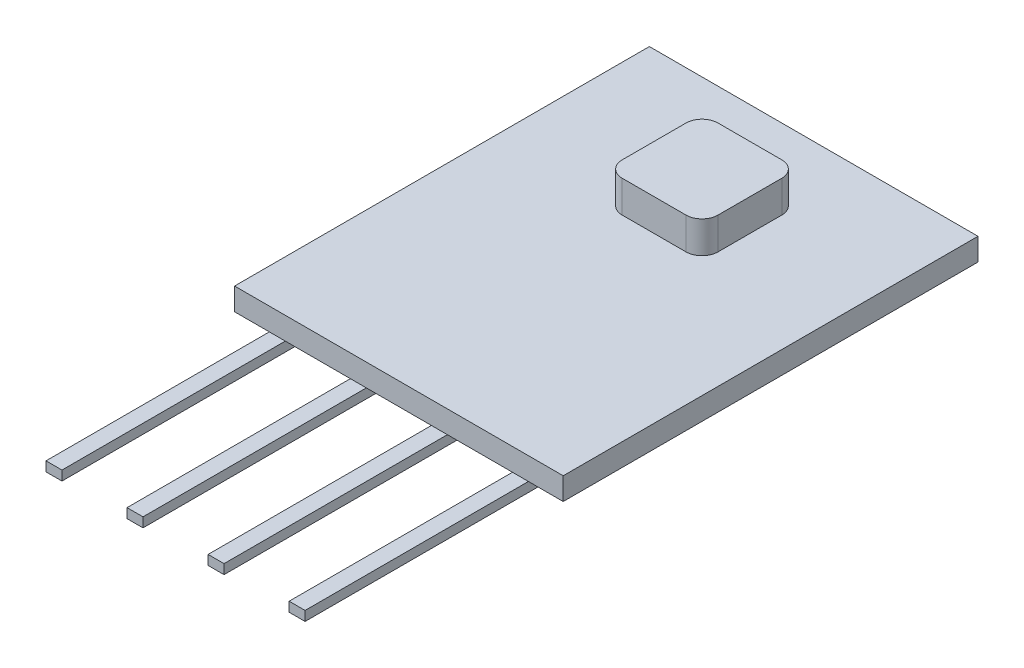
from build123d import *

# Parameters (mm, degrees)
SKETCH_1_W                   = 10.3
SKETCH_1_H                   = 13
EXTRUDE_1_DEPTH              = 0.7
SKETCH_2_W                   = 3
SKETCH_2_H                   = 3
EXTRUDE_2_DEPTH              = 1
FILLET_1_R                   = 0.5
SKETCH_3_W                   = 0.5
SKETCH_3_H                   = 0.5
EXTRUDE_3_DEPTH              = 0.3
SKETCH_4_W                   = 0.5
SKETCH_4_H                   = 0.3
EXTRUDE_4_DEPTH              = 7
PATTERN_START                = 3.56
PATTERN_LINEAR_1_OUTLINE_W   = 0.3
PATTERN_LINEAR_1_OUTLINE_H   = 0.5
PATTERN_LINEAR_1_DEPTH       = 0.5
PATTERN_START_2              = 1.02
PATTERN_LINEAR_1_2_OUTLINE_W = 0.3
PATTERN_LINEAR_1_2_OUTLINE_H = 0.5
PATTERN_LINEAR_1_2_DEPTH     = 0.5
PATTERN_START_3              = -1.52
PATTERN_LINEAR_1_3_OUTLINE_W = 0.3
PATTERN_LINEAR_1_3_OUTLINE_H = 0.5
PATTERN_LINEAR_1_3_DEPTH     = 0.5
PATTERN_START_4              = 6
PATTERN_LINEAR_1_4_OUTLINE_W = 0.5
PATTERN_LINEAR_1_4_OUTLINE_H = 0.3
PATTERN_LINEAR_1_4_DEPTH     = 7.5


# Read off the part's stored shape, not the designer's step: Линейный массив1
with BuildPart() as part:
    # Эскиз1 → Бобышка-Вытянуть1 (new body)
    with BuildSketch(Plane(origin=(0, 0, 0), x_dir=(1, 0, 0), z_dir=(0, 1, 0))):
        Rectangle(SKETCH_1_W, SKETCH_1_H)
    extrude(amount=EXTRUDE_1_DEPTH)



with BuildPart() as body_2:
    # Эскиз2 → Бобышка-Вытянуть2 (new body)
    with BuildSketch(Plane(origin=(0, 0.7, 0), x_dir=(1, 0, 0), z_dir=(0, 1, 0))):
        with Locations((0, 3)):
            Rectangle(SKETCH_2_W, SKETCH_2_H)
    extrude(amount=EXTRUDE_2_DEPTH)

    # Скругление1
    fillet_1_edges = [body_2.edges().sort_by_distance(p)[0] for p in [
        (1.5, 1.2, -1.5),
        (-1.5, 1.2, -1.5),
        (-1.5, 1.2, -4.5),
        (1.5, 1.2, -4.5),
    ]]
    fillet(fillet_1_edges, radius=FILLET_1_R)


with BuildPart() as body_3:
    # Эскиз3 → Бобышка-Вытянуть3 (new body)
    with BuildSketch(Plane.XZ):
        with Locations((-3.81, 6.25)):
            Rectangle(SKETCH_3_W, SKETCH_3_H)
    extrude(amount=EXTRUDE_3_DEPTH)


with BuildPart() as part_1:
    add(part.part)

    add(body_3.part)  # Бобышка-Вытянуть4 merges body 3
    # Эскиз4 → Бобышка-Вытянуть4 (add)
    with BuildSketch(Plane.XY.offset(6.5)):
        with Locations((-3.81, -0.15)):
            Rectangle(SKETCH_4_W, SKETCH_4_H)
    extrude(amount=EXTRUDE_4_DEPTH)

    # Pattern Linear 1 4 outline → Pattern Linear 1 4 (add)
    with BuildSketch(Plane.XY.offset(PATTERN_START_4)):
        with Locations((-1.27, -0.15)):
            Rectangle(PATTERN_LINEAR_1_4_OUTLINE_W, PATTERN_LINEAR_1_4_OUTLINE_H)
        with Locations((1.27, -0.15)):
            Rectangle(PATTERN_LINEAR_1_4_OUTLINE_W, PATTERN_LINEAR_1_4_OUTLINE_H)
        with Locations((3.81, -0.15)):
            Rectangle(PATTERN_LINEAR_1_4_OUTLINE_W, PATTERN_LINEAR_1_4_OUTLINE_H)
    extrude(amount=PATTERN_LINEAR_1_4_DEPTH)


with BuildPart() as body_3_2:
    # Линейный массив1 outline → Линейный массив1 (new body)
    with BuildSketch(Plane.YZ.offset(PATTERN_START)):
        with Locations((-0.15, 6.25)):
            Rectangle(PATTERN_LINEAR_1_OUTLINE_W, PATTERN_LINEAR_1_OUTLINE_H)
    extrude(amount=PATTERN_LINEAR_1_DEPTH)


with BuildPart() as body_4:
    # Pattern Linear 1 2 outline → Pattern Linear 1 2 (new body)
    with BuildSketch(Plane.YZ.offset(PATTERN_START_2)):
        with Locations((-0.15, 6.25)):
            Rectangle(PATTERN_LINEAR_1_2_OUTLINE_W, PATTERN_LINEAR_1_2_OUTLINE_H)
    extrude(amount=PATTERN_LINEAR_1_2_DEPTH)


with BuildPart() as body_5:
    # Pattern Linear 1 3 outline → Pattern Linear 1 3 (new body)
    with BuildSketch(Plane.YZ.offset(PATTERN_START_3)):
        with Locations((-0.15, 6.25)):
            Rectangle(PATTERN_LINEAR_1_3_OUTLINE_W, PATTERN_LINEAR_1_3_OUTLINE_H)
    extrude(amount=PATTERN_LINEAR_1_3_DEPTH)


solid = Compound([body_2.part, part_1.part, body_3_2.part, body_4.part, body_5.part])
